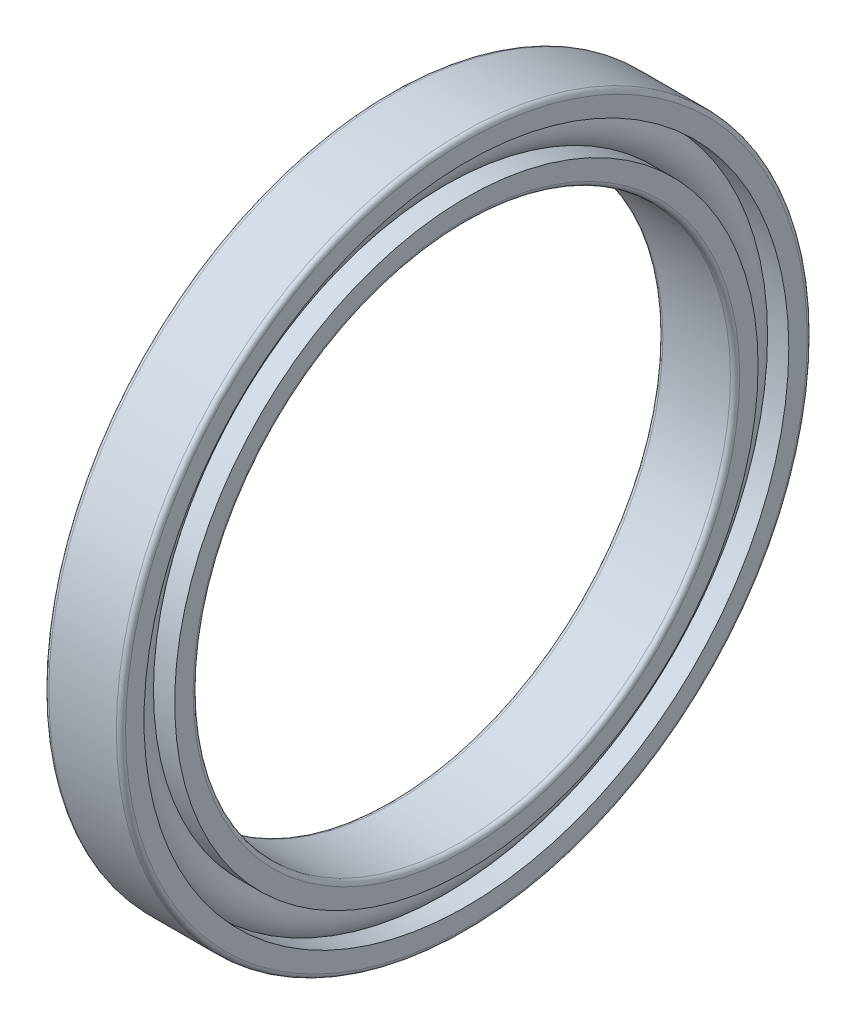
from build123d import *

# Parameters (mm, degrees)
CAGSPISKE_W     = 0.6
CAGSPISKE_H     = 1
CAGESPINE_ANGLE = 0.001
BALSIMSKE_R     = 3


with BuildPart() as part:
    # CagSpiSke → CageSpine (revolve)
    with BuildSketch(Plane.XY):
        with Locations((0, 40)):
            Rectangle(CAGSPISKE_W, CAGSPISKE_H)
    revolve(axis=Axis((-20.6375, 0, 0), (-1, 0, 0)), revolution_arc=CAGESPINE_ANGLE)

    # BalSimSke → BallsSimplified (revolve)
    with BuildSketch(Plane.XY):
        with Locations((0, 40)):
            Circle(BALSIMSKE_R)
    revolve(axis=Axis((-10, 0, 0), (1, 0, 0)))

    # InnRacSke → InnerRace (revolve)
    with BuildSketch(Plane.XY):
        with BuildLine():
            Line((-2.202413449, 38), (-5, 38))
            Line((-5, 38), (-5, 35.6))
            ThreePointArc((-5, 35.6), (-4.824264069, 35.175735931), (-4.4, 35))
            Line((-4.4, 35), (4.4, 35))
            ThreePointArc((4.4, 35), (4.824264069, 35.175735931), (5, 35.6))
            Line((5, 35.6), (5, 38))
            Line((5, 38), (2.202413449, 38))
            ThreePointArc((2.202413449, 38), (0, 37.025), (-2.202413449, 38))
        make_face()
    revolve(axis=Axis((-20.6375, 0, 0), (1, 0, 0)))

    # OutRacSke → OuterRace (revolve)
    with BuildSketch(Plane.XY):
        with BuildLine():
            Line((-2.202413449, 42), (-5, 42))
            Line((-5, 42), (-5, 44.4))
            ThreePointArc((-5, 44.4), (-4.824264069, 44.824264069), (-4.4, 45))
            Line((-4.4, 45), (4.4, 45))
            ThreePointArc((4.4, 45), (4.824264069, 44.824264069), (5, 44.4))
            Line((5, 44.4), (5, 42))
            Line((5, 42), (2.202413449, 42))
            ThreePointArc((2.202413449, 42), (0, 42.975), (-2.202413449, 42))
        make_face()
    revolve(axis=Axis((-20.6375, 0, 0), (1, 0, 0)))


solid = part.part
